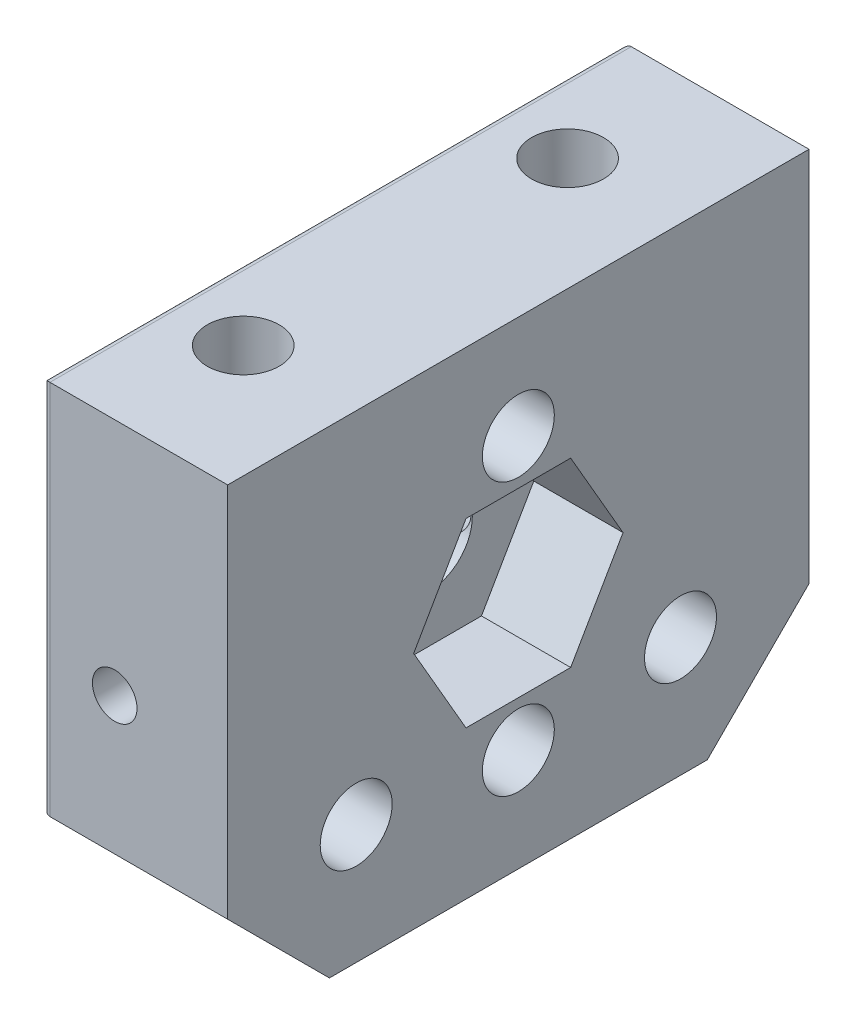
from build123d import *

# Parameters (mm, degrees)
SZKIC1_W                        = 40.399619214
SZKIC1_H                        = 33.210925784
SZKIC1_R                        = 3
DODANIE_WYCI_GNI_CIE1_DEPTH     = 10
WYTNIJ_WYCI_GNI_CIE1_DEPTH      = 45.80926947
WYTNIJ_WYCI_GNI_CIE1_DEPTH_BACK = 45.80926947
SZKIC2_R                        = 1.55
SZKIC4_R                        = 6.65
WYTNIJ_WYCI_GNI_CIE2_DEPTH      = 3
WYTNIJ_WYCI_GNI_CIE3_DEPTH      = 2
WYTNIJ_WYCI_GNI_CIE6_REACH      = 29.996
SZKIC6_W                        = 9.237604307
SZKIC6_H                        = 4
SZKIC7_R                        = 2.5
WYTNIJ_WYCI_GNI_CIE7_DEPTH      = 16.605462892
SZKIC8_R                        = 5.25
WYTNIJ_WYCI_GNI_CIE8_DEPTH      = 6
SZKIC9_R                        = 2.5
WYTNIJ_WYCI_GNI_CIE9_DEPTH      = 27.828598734
WYTNIJ_WYCI_GNI_CIE10_DEPTH     = 28.995958852
SZKIC12_R                       = 2.5
WYTNIJ_WYCI_GNI_CIE11_DEPTH     = 28.995958852
ZAOKR_GLENIE1_R                 = 0.5
SZKIC13_R                       = 2.5
SZKIC13_R_2                     = 3
DODANIE_WYCI_GNI_CIE2_DEPTH     = 2.85
WYTNIJ_WYCI_GNI_CIE12_DEPTH     = 6.2


with BuildPart() as part:
    # Szkic1 → Dodanie-wyciągnięcie1 (new body)
    with BuildSketch(Plane(origin=(0, 0, 0), x_dir=(0, 0, -1), z_dir=(1, 0, 0))):
        Rectangle(SZKIC1_W, SZKIC1_H)
        Circle(SZKIC1_R, mode=Mode.SUBTRACT)
    extrude(amount=DODANIE_WYCI_GNI_CIE1_DEPTH)

    # Szkic2 → Wytnij-wyciągnięcie1 (cut, two sides: drawn at the far end of the back side and taken through both)
    with BuildSketch(Plane.XY.offset(20.199809607).offset(-WYTNIJ_WYCI_GNI_CIE1_DEPTH_BACK)):
        with Locations((5, 0)):
            Circle(SZKIC2_R)
    extrude(amount=WYTNIJ_WYCI_GNI_CIE1_DEPTH + WYTNIJ_WYCI_GNI_CIE1_DEPTH_BACK, mode=Mode.SUBTRACT)

    # Szkic4 → Wytnij-wyciągnięcie2 (cut)
    with BuildSketch(Plane.ZY):
        Circle(SZKIC4_R)
    extrude(amount=-WYTNIJ_WYCI_GNI_CIE2_DEPTH, mode=Mode.SUBTRACT)

    # Szkic5 → Wytnij-wyciągnięcie3 (cut, symmetric)
    with BuildSketch(Plane(origin=(0, 8.302731446, 0), x_dir=(1, 0, 0), z_dir=(0, 1, 0))):
        Polygon((9, -13.57820323), (9, -8.959401077), (5, -6.65), (1, -8.959401077), (1, -13.57820323), (5, -15.887604307), align=None)
    wytnij_wyci_gni_cie3 = extrude(amount=WYTNIJ_WYCI_GNI_CIE3_DEPTH, both=True, mode=Mode.SUBTRACT)

    # Szkic6 → Wytnij-wyciągnięcie6 (cut, up to next)
    with BuildSketch(Plane.ZY, mode=Mode.PRIVATE) as wytnij_wyci_gni_cie6_sk1:
        with Locations((11.268802154, 8.302731446)):
            Rectangle(SZKIC6_W, SZKIC6_H)
    wytnij_wyci_gni_cie6_tool1 = extrude(wytnij_wyci_gni_cie6_sk1.sketch, amount=-WYTNIJ_WYCI_GNI_CIE6_REACH, mode=Mode.PRIVATE) & part.part
    wytnij_wyci_gni_cie6 = wytnij_wyci_gni_cie6_tool1.solids().sort_by_distance((0, 8.302731, 11.268802))[0]
    add(wytnij_wyci_gni_cie6, mode=Mode.SUBTRACT)

    # Szkic7 → Wytnij-wyciągnięcie7 (cut)
    with BuildSketch(Plane(origin=(0, 16.605462892, 0), x_dir=(1, 0, 0), z_dir=(0, 1, 0))):
        with Locations(Location((5, -11.268802154, 0), (0, 0, 270))):
            Circle(SZKIC7_R)
    wytnij_wyci_gni_cie7 = extrude(amount=-WYTNIJ_WYCI_GNI_CIE7_DEPTH, mode=Mode.SUBTRACT)

    # Szkic8 → Wytnij-wyciągnięcie8 (cut)
    with BuildSketch(Plane.ZY):
        with Locations((11.268802154, -8.302731446)):
            Circle(SZKIC8_R)
    wytnij_wyci_gni_cie8 = extrude(amount=-WYTNIJ_WYCI_GNI_CIE8_DEPTH, mode=Mode.SUBTRACT)

    # Szkic9 → Wytnij-wyciągnięcie9 (cut, through all)
    with BuildSketch(Plane.ZY.offset(-6)):
        with Locations((11.268802154, -8.302731446)):
            Circle(SZKIC9_R)
    wytnij_wyci_gni_cie9 = extrude(amount=-WYTNIJ_WYCI_GNI_CIE9_DEPTH, mode=Mode.SUBTRACT)

    # Szkic10 → Wytnij-wyciągnięcie10 (cut, through all)
    with BuildSketch(Plane.ZY):
        Polygon((13.128741795, -16.605462892), (20.199809607, -9.53439508), (20.199809607, -16.605462892), align=None)
    wytnij_wyci_gni_cie10 = extrude(amount=-WYTNIJ_WYCI_GNI_CIE10_DEPTH, mode=Mode.SUBTRACT)

    # Lustro1: Wytnij-wyciągnięcie3, Wytnij-wyciągnięcie6, Wytnij-wyciągnięcie7, Wytnij-wyciągnięcie8, Wytnij-wyciągnięcie9, Wytnij-wyciągnięcie10 across plane
    add(wytnij_wyci_gni_cie3.mirror(Plane.XY), mode=Mode.SUBTRACT)
    add(wytnij_wyci_gni_cie6.mirror(Plane.XY), mode=Mode.SUBTRACT)
    add(wytnij_wyci_gni_cie7.mirror(Plane.XY), mode=Mode.SUBTRACT)
    add(wytnij_wyci_gni_cie8.mirror(Plane.XY), mode=Mode.SUBTRACT)
    add(wytnij_wyci_gni_cie9.mirror(Plane.XY), mode=Mode.SUBTRACT)
    add(wytnij_wyci_gni_cie10.mirror(Plane.XY), mode=Mode.SUBTRACT)

    # Szkic12 → Wytnij-wyciągnięcie11 (cut, through all)
    with BuildSketch(Plane.ZY):
        with Locations((0, 9.460495367)):
            Circle(SZKIC12_R)
    wytnij_wyci_gni_cie11 = extrude(amount=-WYTNIJ_WYCI_GNI_CIE11_DEPTH, mode=Mode.SUBTRACT)

    # Lustro2: Wytnij-wyciągnięcie11 across plane
    add(wytnij_wyci_gni_cie11.mirror(Plane(origin=(0, 0, 0), x_dir=(0, 0, 1), z_dir=(0, -1, 0))), mode=Mode.SUBTRACT)

    # Zaokrąglenie1
    # the kernel refuses this fillet: 0.5 mm, written as the material it takes off along each edge
    with BuildSketch(Plane(origin=(0, 6.302731446, -15.887604307), x_dir=(0, -1, 0), z_dir=(0, 0, 1)), Plane(origin=(0, 10.302731446, -6.65), x_dir=(0, 1, 0), z_dir=(0, 0, -1))) as zaokr_glenie1_piece_1:
        with BuildLine():
            CenterArc((ZAOKR_GLENIE1_R, ZAOKR_GLENIE1_R), ZAOKR_GLENIE1_R, 180, 90)
            Line((0, ZAOKR_GLENIE1_R), (0, 0))
            Line((0, 0), (ZAOKR_GLENIE1_R, 0))
        make_face()
    extrude(amount=9.237604307, mode=Mode.SUBTRACT)
    with BuildSketch(Plane(origin=(0, 10.302731446, -15.887604307), x_dir=(0, 0, -1), z_dir=(0, -1, 0)), Plane(origin=(0, 6.302731446, -6.65), x_dir=(0, 0, 1), z_dir=(0, 1, 0))) as zaokr_glenie1_piece_2:
        with BuildLine():
            CenterArc((ZAOKR_GLENIE1_R, ZAOKR_GLENIE1_R), ZAOKR_GLENIE1_R, 180, 90)
            Line((0, ZAOKR_GLENIE1_R), (0, 0))
            Line((0, 0), (ZAOKR_GLENIE1_R, 0))
        make_face()
    extrude(amount=4, mode=Mode.SUBTRACT)
    with BuildSketch(Plane(origin=(0, -8.302731446, -11.268802154), x_dir=(0, 0, -1), z_dir=(0, -1, 0))) as zaokr_glenie1_piece_3:
        with BuildLine():
            CenterArc((5.25 + ZAOKR_GLENIE1_R, ZAOKR_GLENIE1_R), ZAOKR_GLENIE1_R, 180, 90)
            Line((5.25, ZAOKR_GLENIE1_R), (5.25, 0))
            Line((5.25, 0), (5.25 + ZAOKR_GLENIE1_R, 0))
        make_face()
    revolve(axis=Axis((0, -8.302731446, -11.268802154), (1, 0, 0)), mode=Mode.SUBTRACT)
    with BuildSketch(Plane(origin=(0, -10.78439508, -20.199809607), x_dir=(0, 0, 1), z_dir=(0, 1, 0)), Plane(origin=(0, 17.855462892, 20.199809607), x_dir=(0, 0, -1), z_dir=(0, -1, 0))) as zaokr_glenie1_piece_4:
        with BuildLine():
            CenterArc((ZAOKR_GLENIE1_R, ZAOKR_GLENIE1_R), ZAOKR_GLENIE1_R, 180, 90)
            Line((0, ZAOKR_GLENIE1_R), (0, 0))
            Line((0, 0), (ZAOKR_GLENIE1_R, 0))
        make_face()
    extrude(amount=28.639857971, mode=Mode.SUBTRACT)
    with BuildSketch(Plane(origin=(0, -17.489346368, -12.244858318), x_dir=(0, 0.7071067811865435, 0.7071067811865517), z_dir=(0, 0.7071067811865516, -0.7071067811865435))) as zaokr_glenie1_piece_5:
        with BuildLine():
            CenterArc((ZAOKR_GLENIE1_R, ZAOKR_GLENIE1_R), ZAOKR_GLENIE1_R, 180, 90)
            Line((0, ZAOKR_GLENIE1_R), (0, 0))
            Line((0, 0), (ZAOKR_GLENIE1_R, 0))
        make_face()
    extrude(amount=12.5, mode=Mode.SUBTRACT)
    with BuildSketch(Plane(origin=(0, 9.460495367, 0), x_dir=(0, 0, 1), z_dir=(0, -1, 0))) as zaokr_glenie1_piece_6:
        with BuildLine():
            CenterArc((2.5 + ZAOKR_GLENIE1_R, -ZAOKR_GLENIE1_R), ZAOKR_GLENIE1_R, 90, 90)
            Line((2.5, -ZAOKR_GLENIE1_R), (2.5, 0))
            Line((2.5, 0), (2.5 + ZAOKR_GLENIE1_R, 0))
        make_face()
    revolve(axis=Axis((0, 9.460495367, 0), (-1, 0, 0)), mode=Mode.SUBTRACT)
    with BuildSketch(Plane(origin=(0, -9.460495367, 0), x_dir=(0, 0, 1), z_dir=(0, 1, 0))) as zaokr_glenie1_piece_7:
        with BuildLine():
            CenterArc((2.5 + ZAOKR_GLENIE1_R, ZAOKR_GLENIE1_R), ZAOKR_GLENIE1_R, 180, 90)
            Line((2.5, ZAOKR_GLENIE1_R), (2.5, 0))
            Line((2.5, 0), (2.5 + ZAOKR_GLENIE1_R, 0))
        make_face()
    revolve(axis=Axis((0, -9.460495367, 0), (1, 0, 0)), mode=Mode.SUBTRACT)
    with BuildSketch(Plane(origin=(0, 0, 0), x_dir=(0, 0, 1), z_dir=(0, -1, 0))) as zaokr_glenie1_piece_8:
        with BuildLine():
            CenterArc((6.65 + ZAOKR_GLENIE1_R, -ZAOKR_GLENIE1_R), ZAOKR_GLENIE1_R, 90, 90)
            Line((6.65, -ZAOKR_GLENIE1_R), (6.65, 0))
            Line((6.65, 0), (6.65 + ZAOKR_GLENIE1_R, 0))
        make_face()
    revolve(axis=Axis((0, 0, 0), (-1, 0, 0)), mode=Mode.SUBTRACT)
    with BuildSketch(Plane(origin=(0, 6.302731446, 15.887604307), x_dir=(0, -1, 0), z_dir=(0, 0, -1)), Plane(origin=(0, 10.302731446, 6.65), x_dir=(0, 1, 0), z_dir=(0, 0, 1))) as zaokr_glenie1_piece_9:
        with BuildLine():
            CenterArc((ZAOKR_GLENIE1_R, -ZAOKR_GLENIE1_R), ZAOKR_GLENIE1_R, 90, 90)
            Line((0, -ZAOKR_GLENIE1_R), (0, 0))
            Line((0, 0), (ZAOKR_GLENIE1_R, 0))
        make_face()
    extrude(amount=9.237604307, mode=Mode.SUBTRACT)
    with BuildSketch(Plane(origin=(0, 10.302731446, 15.887604307), x_dir=(0, 0, 1), z_dir=(0, -1, 0)), Plane(origin=(0, 6.302731446, 6.65), x_dir=(0, 0, -1), z_dir=(0, 1, 0))) as zaokr_glenie1_piece_10:
        with BuildLine():
            CenterArc((ZAOKR_GLENIE1_R, -ZAOKR_GLENIE1_R), ZAOKR_GLENIE1_R, 90, 90)
            Line((0, -ZAOKR_GLENIE1_R), (0, 0))
            Line((0, 0), (ZAOKR_GLENIE1_R, 0))
        make_face()
    extrude(amount=4, mode=Mode.SUBTRACT)
    with BuildSketch(Plane(origin=(0, 16.605462892, -21.449809607), x_dir=(0, -1, 0), z_dir=(0, 0, 1))) as zaokr_glenie1_piece_11:
        with BuildLine():
            CenterArc((ZAOKR_GLENIE1_R, ZAOKR_GLENIE1_R), ZAOKR_GLENIE1_R, 180, 90)
            Line((0, ZAOKR_GLENIE1_R), (0, 0))
            Line((0, 0), (ZAOKR_GLENIE1_R, 0))
        make_face()
    extrude(amount=42.899619214, mode=Mode.SUBTRACT)
    with BuildSketch(Plane(origin=(0, -8.302731446, 11.268802154), x_dir=(0, 0, 1), z_dir=(0, -1, 0))) as zaokr_glenie1_piece_12:
        with BuildLine():
            CenterArc((5.25 + ZAOKR_GLENIE1_R, -ZAOKR_GLENIE1_R), ZAOKR_GLENIE1_R, 90, 90)
            Line((5.25, -ZAOKR_GLENIE1_R), (5.25, 0))
            Line((5.25, 0), (5.25 + ZAOKR_GLENIE1_R, 0))
        make_face()
    revolve(axis=Axis((0, -8.302731446, 11.268802154), (-1, 0, 0)), mode=Mode.SUBTRACT)
    with BuildSketch(Plane(origin=(0, -16.605462892, 14.378741795), x_dir=(1, 0, 0), z_dir=(0, 0, -1))) as zaokr_glenie1_piece_13:
        with BuildLine():
            CenterArc((ZAOKR_GLENIE1_R, -ZAOKR_GLENIE1_R), ZAOKR_GLENIE1_R, 90, 90)
            Line((0, -ZAOKR_GLENIE1_R), (0, 0))
            Line((0, 0), (ZAOKR_GLENIE1_R, 0))
        make_face()
    extrude(amount=28.75748359, mode=Mode.SUBTRACT)
    with BuildSketch(Plane(origin=(0, -17.489346368, 12.244858318), x_dir=(0, 0.7071067811865436, -0.7071067811865518), z_dir=(0, 0.7071067811865516, 0.7071067811865435))) as zaokr_glenie1_piece_14:
        with BuildLine():
            CenterArc((ZAOKR_GLENIE1_R, -ZAOKR_GLENIE1_R), ZAOKR_GLENIE1_R, 90, 90)
            Line((0, -ZAOKR_GLENIE1_R), (0, 0))
            Line((0, 0), (ZAOKR_GLENIE1_R, 0))
        make_face()
    extrude(amount=12.5, mode=Mode.SUBTRACT)
    with BuildSketch(Plane(origin=(0, 6.302731446, -17.137604307), x_dir=(0, -1, 0), z_dir=(0, 0, 1))) as zaokr_glenie1_piece_15a_section:
        with BuildLine():
            CenterArc((ZAOKR_GLENIE1_R, ZAOKR_GLENIE1_R), ZAOKR_GLENIE1_R, 180, 90)
            Line((0, ZAOKR_GLENIE1_R), (0, 0))
            Line((0, 0), (ZAOKR_GLENIE1_R, 0))
        make_face()
    zaokr_glenie1_piece_15a = extrude(amount=10.487604307, mode=Mode.PRIVATE)
    zaokr_glenie1_piece_15a = split(zaokr_glenie1_piece_15a, bisect_by=Plane(origin=(0.113197557, 6.189533889, -15.887604307), z_dir=(0, 0, -1)), keep=Keep.TOP, mode=Mode.PRIVATE)
    with BuildSketch(Plane(origin=(0, 10.302731446, -15.887604307), x_dir=(0, 0, -1), z_dir=(0, -1, 0))) as zaokr_glenie1_piece_15b_section:
        with BuildLine():
            CenterArc((ZAOKR_GLENIE1_R, ZAOKR_GLENIE1_R), ZAOKR_GLENIE1_R, 180, 90)
            Line((0, ZAOKR_GLENIE1_R), (0, 0))
            Line((0, 0), (ZAOKR_GLENIE1_R, 0))
        make_face()
    zaokr_glenie1_piece_15b = extrude(amount=5.25, mode=Mode.PRIVATE)
    zaokr_glenie1_piece_15b = split(zaokr_glenie1_piece_15b, bisect_by=Plane(origin=(0.113197557, 6.302731446, -16.000801864), z_dir=(0, -1, 0)), keep=Keep.TOP, mode=Mode.PRIVATE)
    zaokr_glenie1_piece_15 = zaokr_glenie1_piece_15a & zaokr_glenie1_piece_15b
    add(zaokr_glenie1_piece_15, mode=Mode.SUBTRACT)
    with BuildSketch(Plane(origin=(0, 6.302731446, -15.887604307), x_dir=(0, -1, 0), z_dir=(0, 0, 1))) as zaokr_glenie1_piece_16a_section:
        with BuildLine():
            CenterArc((ZAOKR_GLENIE1_R, ZAOKR_GLENIE1_R), ZAOKR_GLENIE1_R, 180, 90)
            Line((0, ZAOKR_GLENIE1_R), (0, 0))
            Line((0, 0), (ZAOKR_GLENIE1_R, 0))
        make_face()
    zaokr_glenie1_piece_16a = extrude(amount=10.487604307, mode=Mode.PRIVATE)
    zaokr_glenie1_piece_16a = split(zaokr_glenie1_piece_16a, bisect_by=Plane(origin=(0.113197557, 6.189533889, -6.65), z_dir=(0, 0, 1)), keep=Keep.TOP, mode=Mode.PRIVATE)
    with BuildSketch(Plane(origin=(0, 5.052731446, -6.65), x_dir=(0, 0, 1), z_dir=(0, 1, 0))) as zaokr_glenie1_piece_16b_section:
        with BuildLine():
            CenterArc((ZAOKR_GLENIE1_R, ZAOKR_GLENIE1_R), ZAOKR_GLENIE1_R, 180, 90)
            Line((0, ZAOKR_GLENIE1_R), (0, 0))
            Line((0, 0), (ZAOKR_GLENIE1_R, 0))
        make_face()
    zaokr_glenie1_piece_16b = extrude(amount=5.25, mode=Mode.PRIVATE)
    zaokr_glenie1_piece_16b = split(zaokr_glenie1_piece_16b, bisect_by=Plane(origin=(0.113197557, 6.302731446, -6.536802443), z_dir=(0, -1, 0)), keep=Keep.TOP, mode=Mode.PRIVATE)
    zaokr_glenie1_piece_16 = zaokr_glenie1_piece_16a & zaokr_glenie1_piece_16b
    add(zaokr_glenie1_piece_16, mode=Mode.SUBTRACT)
    with BuildSketch(Plane(origin=(0, 11.552731446, -15.887604307), x_dir=(0, 0, -1), z_dir=(0, -1, 0))) as zaokr_glenie1_piece_17a_section:
        with BuildLine():
            CenterArc((ZAOKR_GLENIE1_R, ZAOKR_GLENIE1_R), ZAOKR_GLENIE1_R, 180, 90)
            Line((0, ZAOKR_GLENIE1_R), (0, 0))
            Line((0, 0), (ZAOKR_GLENIE1_R, 0))
        make_face()
    zaokr_glenie1_piece_17a = extrude(amount=5.25, mode=Mode.PRIVATE)
    zaokr_glenie1_piece_17a = split(zaokr_glenie1_piece_17a, bisect_by=Plane(origin=(0.113197557, 10.302731446, -16.000801864), z_dir=(0, 1, 0)), keep=Keep.TOP, mode=Mode.PRIVATE)
    with BuildSketch(Plane(origin=(0, 10.302731446, -6.65), x_dir=(0, 1, 0), z_dir=(0, 0, -1))) as zaokr_glenie1_piece_17b_section:
        with BuildLine():
            CenterArc((ZAOKR_GLENIE1_R, ZAOKR_GLENIE1_R), ZAOKR_GLENIE1_R, 180, 90)
            Line((0, ZAOKR_GLENIE1_R), (0, 0))
            Line((0, 0), (ZAOKR_GLENIE1_R, 0))
        make_face()
    zaokr_glenie1_piece_17b = extrude(amount=10.487604307, mode=Mode.PRIVATE)
    zaokr_glenie1_piece_17b = split(zaokr_glenie1_piece_17b, bisect_by=Plane(origin=(0.113197557, 10.415929003, -15.887604307), z_dir=(0, 0, -1)), keep=Keep.TOP, mode=Mode.PRIVATE)
    zaokr_glenie1_piece_17 = zaokr_glenie1_piece_17a & zaokr_glenie1_piece_17b
    add(zaokr_glenie1_piece_17, mode=Mode.SUBTRACT)
    with BuildSketch(Plane(origin=(0, 6.302731446, -6.65), x_dir=(0, 0, 1), z_dir=(0, 1, 0))) as zaokr_glenie1_piece_18a_section:
        with BuildLine():
            CenterArc((ZAOKR_GLENIE1_R, ZAOKR_GLENIE1_R), ZAOKR_GLENIE1_R, 180, 90)
            Line((0, ZAOKR_GLENIE1_R), (0, 0))
            Line((0, 0), (ZAOKR_GLENIE1_R, 0))
        make_face()
    zaokr_glenie1_piece_18a = extrude(amount=5.25, mode=Mode.PRIVATE)
    zaokr_glenie1_piece_18a = split(zaokr_glenie1_piece_18a, bisect_by=Plane(origin=(0.113197557, 10.302731446, -6.536802443), z_dir=(0, 1, 0)), keep=Keep.TOP, mode=Mode.PRIVATE)
    with BuildSketch(Plane(origin=(0, 10.302731446, -5.4), x_dir=(0, 1, 0), z_dir=(0, 0, -1))) as zaokr_glenie1_piece_18b_section:
        with BuildLine():
            CenterArc((ZAOKR_GLENIE1_R, ZAOKR_GLENIE1_R), ZAOKR_GLENIE1_R, 180, 90)
            Line((0, ZAOKR_GLENIE1_R), (0, 0))
            Line((0, 0), (ZAOKR_GLENIE1_R, 0))
        make_face()
    zaokr_glenie1_piece_18b = extrude(amount=10.487604307, mode=Mode.PRIVATE)
    zaokr_glenie1_piece_18b = split(zaokr_glenie1_piece_18b, bisect_by=Plane(origin=(0.113197557, 10.415929003, -6.65), z_dir=(0, 0, 1)), keep=Keep.TOP, mode=Mode.PRIVATE)
    zaokr_glenie1_piece_18 = zaokr_glenie1_piece_18a & zaokr_glenie1_piece_18b
    add(zaokr_glenie1_piece_18, mode=Mode.SUBTRACT)
    with BuildSketch(Plane(origin=(0, 6.302731446, 17.137604307), x_dir=(0, -1, 0), z_dir=(0, 0, -1))) as zaokr_glenie1_piece_19a_section:
        with BuildLine():
            CenterArc((ZAOKR_GLENIE1_R, -ZAOKR_GLENIE1_R), ZAOKR_GLENIE1_R, 90, 90)
            Line((0, -ZAOKR_GLENIE1_R), (0, 0))
            Line((0, 0), (ZAOKR_GLENIE1_R, 0))
        make_face()
    zaokr_glenie1_piece_19a = extrude(amount=10.487604307, mode=Mode.PRIVATE)
    zaokr_glenie1_piece_19a = split(zaokr_glenie1_piece_19a, bisect_by=Plane(origin=(0.113197557, 6.189533889, 15.887604307), z_dir=(0, 0, 1)), keep=Keep.TOP, mode=Mode.PRIVATE)
    with BuildSketch(Plane(origin=(0, 10.302731446, 15.887604307), x_dir=(0, 0, 1), z_dir=(0, -1, 0))) as zaokr_glenie1_piece_19b_section:
        with BuildLine():
            CenterArc((ZAOKR_GLENIE1_R, -ZAOKR_GLENIE1_R), ZAOKR_GLENIE1_R, 90, 90)
            Line((0, -ZAOKR_GLENIE1_R), (0, 0))
            Line((0, 0), (ZAOKR_GLENIE1_R, 0))
        make_face()
    zaokr_glenie1_piece_19b = extrude(amount=5.25, mode=Mode.PRIVATE)
    zaokr_glenie1_piece_19b = split(zaokr_glenie1_piece_19b, bisect_by=Plane(origin=(0.113197557, 6.302731446, 16.000801864), z_dir=(0, -1, 0)), keep=Keep.TOP, mode=Mode.PRIVATE)
    zaokr_glenie1_piece_19 = zaokr_glenie1_piece_19a & zaokr_glenie1_piece_19b
    add(zaokr_glenie1_piece_19, mode=Mode.SUBTRACT)
    with BuildSketch(Plane(origin=(0, 5.052731446, 6.65), x_dir=(0, 0, -1), z_dir=(0, 1, 0))) as zaokr_glenie1_piece_20a_section:
        with BuildLine():
            CenterArc((ZAOKR_GLENIE1_R, -ZAOKR_GLENIE1_R), ZAOKR_GLENIE1_R, 90, 90)
            Line((0, -ZAOKR_GLENIE1_R), (0, 0))
            Line((0, 0), (ZAOKR_GLENIE1_R, 0))
        make_face()
    zaokr_glenie1_piece_20a = extrude(amount=5.25, mode=Mode.PRIVATE)
    zaokr_glenie1_piece_20a = split(zaokr_glenie1_piece_20a, bisect_by=Plane(origin=(0.113197557, 6.302731446, 6.536802443), z_dir=(0, -1, 0)), keep=Keep.TOP, mode=Mode.PRIVATE)
    with BuildSketch(Plane(origin=(0, 6.302731446, 15.887604307), x_dir=(0, -1, 0), z_dir=(0, 0, -1))) as zaokr_glenie1_piece_20b_section:
        with BuildLine():
            CenterArc((ZAOKR_GLENIE1_R, -ZAOKR_GLENIE1_R), ZAOKR_GLENIE1_R, 90, 90)
            Line((0, -ZAOKR_GLENIE1_R), (0, 0))
            Line((0, 0), (ZAOKR_GLENIE1_R, 0))
        make_face()
    zaokr_glenie1_piece_20b = extrude(amount=10.487604307, mode=Mode.PRIVATE)
    zaokr_glenie1_piece_20b = split(zaokr_glenie1_piece_20b, bisect_by=Plane(origin=(0.113197557, 6.189533889, 6.65), z_dir=(0, 0, -1)), keep=Keep.TOP, mode=Mode.PRIVATE)
    zaokr_glenie1_piece_20 = zaokr_glenie1_piece_20a & zaokr_glenie1_piece_20b
    add(zaokr_glenie1_piece_20, mode=Mode.SUBTRACT)
    with BuildSketch(Plane(origin=(0, 10.302731446, 6.65), x_dir=(0, 1, 0), z_dir=(0, 0, 1))) as zaokr_glenie1_piece_21a_section:
        with BuildLine():
            CenterArc((ZAOKR_GLENIE1_R, -ZAOKR_GLENIE1_R), ZAOKR_GLENIE1_R, 90, 90)
            Line((0, -ZAOKR_GLENIE1_R), (0, 0))
            Line((0, 0), (ZAOKR_GLENIE1_R, 0))
        make_face()
    zaokr_glenie1_piece_21a = extrude(amount=10.487604307, mode=Mode.PRIVATE)
    zaokr_glenie1_piece_21a = split(zaokr_glenie1_piece_21a, bisect_by=Plane(origin=(0.113197557, 10.415929003, 15.887604307), z_dir=(0, 0, 1)), keep=Keep.TOP, mode=Mode.PRIVATE)
    with BuildSketch(Plane(origin=(0, 11.552731446, 15.887604307), x_dir=(0, 0, 1), z_dir=(0, -1, 0))) as zaokr_glenie1_piece_21b_section:
        with BuildLine():
            CenterArc((ZAOKR_GLENIE1_R, -ZAOKR_GLENIE1_R), ZAOKR_GLENIE1_R, 90, 90)
            Line((0, -ZAOKR_GLENIE1_R), (0, 0))
            Line((0, 0), (ZAOKR_GLENIE1_R, 0))
        make_face()
    zaokr_glenie1_piece_21b = extrude(amount=5.25, mode=Mode.PRIVATE)
    zaokr_glenie1_piece_21b = split(zaokr_glenie1_piece_21b, bisect_by=Plane(origin=(0.113197557, 10.302731446, 16.000801864), z_dir=(0, 1, 0)), keep=Keep.TOP, mode=Mode.PRIVATE)
    zaokr_glenie1_piece_21 = zaokr_glenie1_piece_21a & zaokr_glenie1_piece_21b
    add(zaokr_glenie1_piece_21, mode=Mode.SUBTRACT)
    with BuildSketch(Plane(origin=(0, 6.302731446, 6.65), x_dir=(0, 0, -1), z_dir=(0, 1, 0))) as zaokr_glenie1_piece_22a_section:
        with BuildLine():
            CenterArc((ZAOKR_GLENIE1_R, -ZAOKR_GLENIE1_R), ZAOKR_GLENIE1_R, 90, 90)
            Line((0, -ZAOKR_GLENIE1_R), (0, 0))
            Line((0, 0), (ZAOKR_GLENIE1_R, 0))
        make_face()
    zaokr_glenie1_piece_22a = extrude(amount=5.25, mode=Mode.PRIVATE)
    zaokr_glenie1_piece_22a = split(zaokr_glenie1_piece_22a, bisect_by=Plane(origin=(0.113197557, 10.302731446, 6.536802443), z_dir=(0, 1, 0)), keep=Keep.TOP, mode=Mode.PRIVATE)
    with BuildSketch(Plane(origin=(0, 10.302731446, 5.4), x_dir=(0, 1, 0), z_dir=(0, 0, 1))) as zaokr_glenie1_piece_22b_section:
        with BuildLine():
            CenterArc((ZAOKR_GLENIE1_R, -ZAOKR_GLENIE1_R), ZAOKR_GLENIE1_R, 90, 90)
            Line((0, -ZAOKR_GLENIE1_R), (0, 0))
            Line((0, 0), (ZAOKR_GLENIE1_R, 0))
        make_face()
    zaokr_glenie1_piece_22b = extrude(amount=10.487604307, mode=Mode.PRIVATE)
    zaokr_glenie1_piece_22b = split(zaokr_glenie1_piece_22b, bisect_by=Plane(origin=(0.113197557, 10.415929003, 6.65), z_dir=(0, 0, -1)), keep=Keep.TOP, mode=Mode.PRIVATE)
    zaokr_glenie1_piece_22 = zaokr_glenie1_piece_22a & zaokr_glenie1_piece_22b
    add(zaokr_glenie1_piece_22, mode=Mode.SUBTRACT)

    # Szkic13 → Dodanie-wyciągnięcie2 (add)
    with BuildSketch(Plane(origin=(10, 0, 0), x_dir=(0, 0, -1), z_dir=(1, 0, 0))):
        Polygon((13.128741795, -16.605462892), (20.199809607, -9.53439508), (20.199809607, 16.605462892), (-20.199809607, 16.605462892), (-20.199809607, -9.53439508), (-13.128741795, -16.605462892), align=None)
        with Locations(Location((-11.268802154, -8.302731446, 0), (0, 0, 180))):
            Circle(SZKIC13_R, mode=Mode.SUBTRACT)
        with Locations(Location((0, -9.460495367, 0), (0, 0, 180))):
            Circle(SZKIC13_R, mode=Mode.SUBTRACT)
        with Locations((11.268802154, -8.302731446)):
            Circle(SZKIC13_R, mode=Mode.SUBTRACT)
        with Locations(Location((0, 9.460495367, 0), (0, 0, 180))):
            Circle(SZKIC13_R, mode=Mode.SUBTRACT)
        with Locations(Location((0, 0, 0), (0, 0, 180))):
            Circle(SZKIC13_R_2, mode=Mode.SUBTRACT)
    extrude(amount=DODANIE_WYCI_GNI_CIE2_DEPTH)

    # Szkic14 → Wytnij-wyciągnięcie12 (cut)
    with BuildSketch(Plane(origin=(12.85, 0, 0), x_dir=(0, 0, -1), z_dir=(1, 0, 0))):
        Polygon((3.637306696, 6.3), (-3.637306696, 6.3), (-7.274613392, 0), (-3.637306696, -6.3), (3.637306696, -6.3), (7.274613392, 0), align=None)
    extrude(amount=-WYTNIJ_WYCI_GNI_CIE12_DEPTH, mode=Mode.SUBTRACT)


solid = part.part
